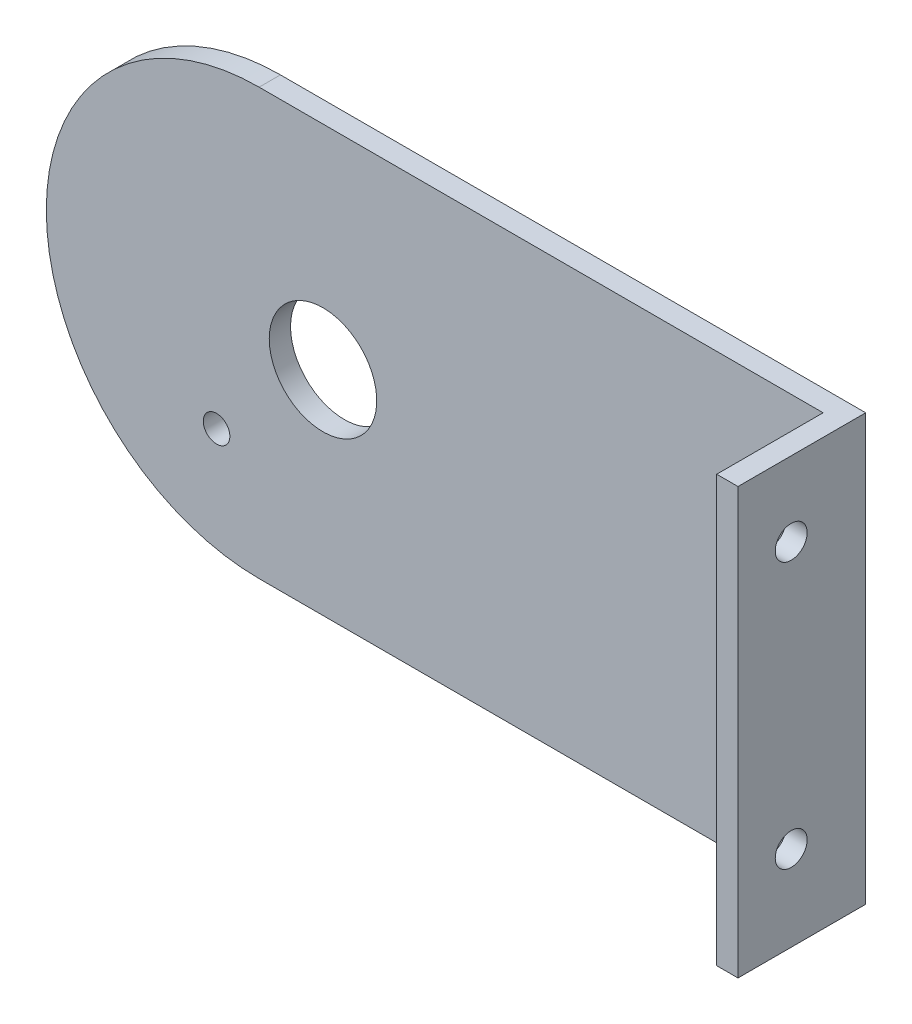
from build123d import *

# Parameters (mm, degrees)
SKETCH_2_W          = 75
SKETCH_2_H          = 40
EXTRUDE_1_DEPTH     = 2
SKETCH_3_R          = 5.05
SKETCH_3_R_2        = 1.25
CUT_EXTRUDE_1_DEPTH = 86.023526156
FILLET_1_R          = 20
SKETCH_7_W          = 2
SKETCH_7_H          = 40
EXTRUDE_3_DEPTH     = 12
SKETCH_8_R          = 1.5
CUT_EXTRUDE_2_DEPTH = 10


with BuildPart() as part:
    # 草图2 → 凸台-拉伸1 (new body)
    with BuildSketch(Plane.XY):
        with Locations((37.5, 20)):
            Rectangle(SKETCH_2_W, SKETCH_2_H)
    extrude(amount=EXTRUDE_1_DEPTH)

    # 草图3 → 切除-拉伸1 (cut, through all)
    with BuildSketch(Plane(origin=(0, 0, 0), x_dir=(-1, 0, 0), z_dir=(0, 0, -1))):
        with Locations((-26, 20)):
            Circle(SKETCH_3_R)
        with Locations((-16, 10.202041029)):
            Circle(SKETCH_3_R_2)
    extrude(amount=-CUT_EXTRUDE_1_DEPTH, mode=Mode.SUBTRACT)

    # 圆角1
    fillet_1_edges = [part.edges().sort_by_distance(p)[0] for p in [
        (0, 40, 1),
        (0, 0, 1),
    ]]
    fillet(fillet_1_edges, radius=FILLET_1_R - 0.0001)  # a hair under: the kernel refuses the full size

    # 草图7 → 凸台-拉伸3 (add)
    with BuildSketch(Plane(origin=(0, 0, 0), x_dir=(-1, 0, 0), z_dir=(0, 0, -1))):
        with Locations((-74, 20)):
            Rectangle(SKETCH_7_W, SKETCH_7_H)
    extrude(amount=-EXTRUDE_3_DEPTH)

    # 草图8 → 切除-拉伸2 (cut)
    with BuildSketch(Plane.ZY.offset(-73)):
        with Locations((7, 33)):
            Circle(SKETCH_8_R)
        with Locations((7, 8)):
            Circle(SKETCH_8_R)
    extrude(amount=-CUT_EXTRUDE_2_DEPTH, mode=Mode.SUBTRACT)


solid = part.part
